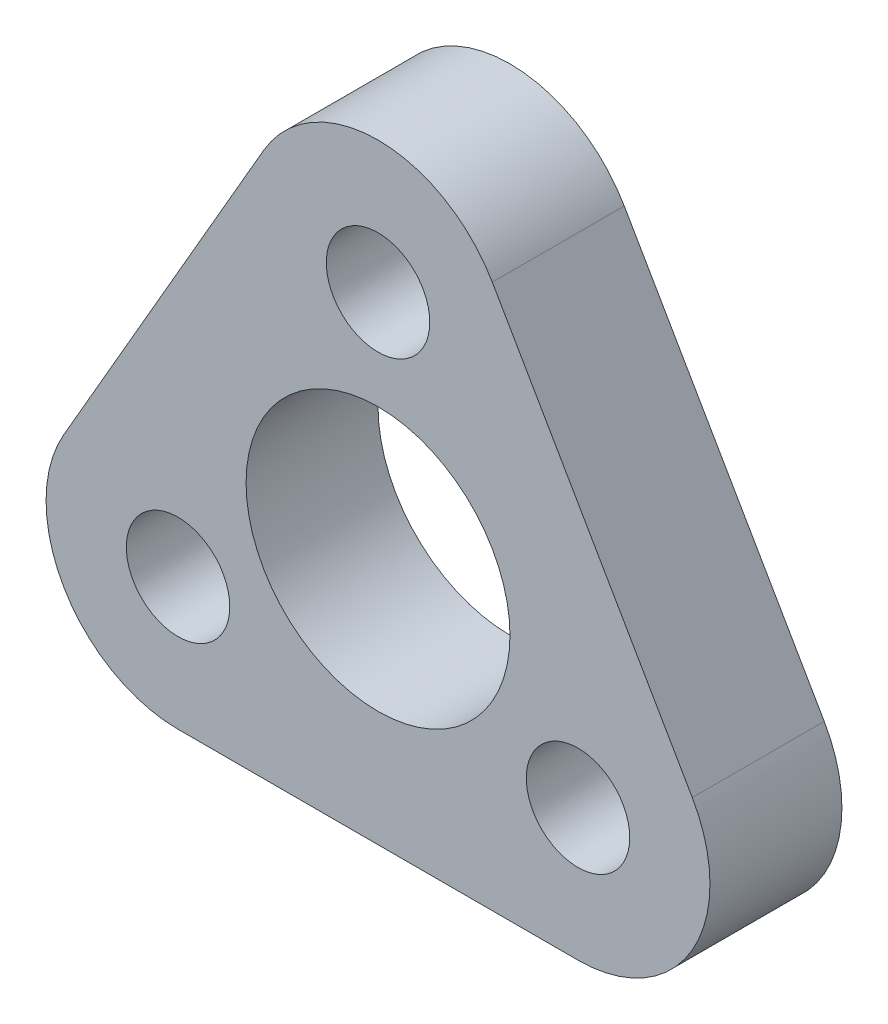
from build123d import *

# Parameters (mm, degrees)
SKETCH1_R           = 6.35
SKETCH1_R_2         = 2.4892
BOSS_EXTRUDE1_DEPTH = 6.35
FILLET1_R           = 6.35


with BuildPart() as part:
    # Sketch1 → Boss-Extrude1 (new body)
    with BuildSketch(Plane.XY):
        Polygon((0, 23.8125), (20.622229928, -11.90625), (-20.622229928, -11.90625), align=None)
        Circle(SKETCH1_R, mode=Mode.SUBTRACT)
        with Locations((0, 11.1125)):
            Circle(SKETCH1_R_2, mode=Mode.SUBTRACT)
        with Locations((9.6237073, -5.55625)):
            Circle(SKETCH1_R_2, mode=Mode.SUBTRACT)
        with Locations((-9.6237073, -5.55625)):
            Circle(SKETCH1_R_2, mode=Mode.SUBTRACT)
    extrude(amount=BOSS_EXTRUDE1_DEPTH)

    # Fillet1
    fillet1_edges = [part.edges().sort_by_distance(p)[0] for p in [
        (20.622229928, -11.90625, 3.175),
        (-20.622229928, -11.90625, 3.175),
        (0, 23.8125, 3.175),
    ]]
    fillet(fillet1_edges, radius=FILLET1_R)


solid = part.part
